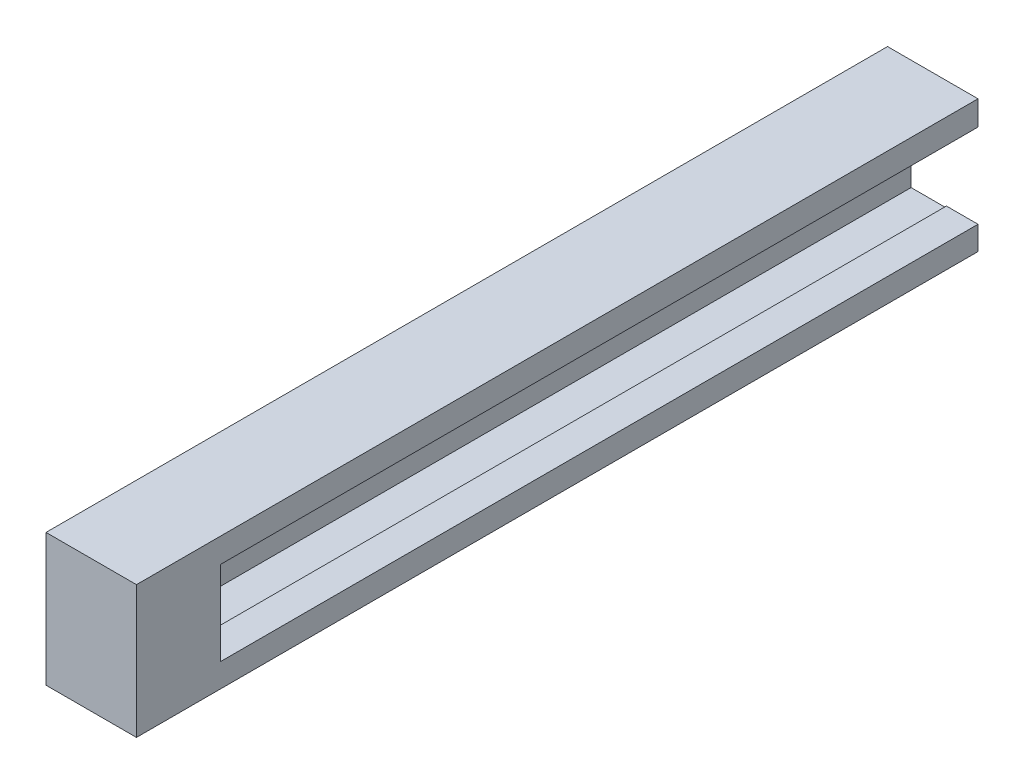
from build123d import *

# Parameters (mm, degrees)
BOSS_EXTRUDE3_DEPTH   = 90
BOSS_EXTRUDE3_2_DEPTH = 90
SKETCH3_W             = 10.75
SKETCH3_H             = 15.726491146
BOSS_EXTRUDE4_DEPTH   = 10


with BuildPart() as part:
    # Sketch2 → Boss-Extrude3 (new body)
    with BuildSketch(Plane.XY):
        Polygon((16.75, 6), (13, 6), (13, 5.8), (8.8, 5.8), (8.8, 8.3), (6, 8.3), (6, 3.186754427), (16.75, 3.186754427), align=None)
    extrude(amount=BOSS_EXTRUDE3_DEPTH)



with BuildPart() as body_2:
    # Sketch2 → Boss-Extrude3 2 (new body)
    with BuildSketch(Plane.XY):
        Polygon((6, 18.913245573), (6, 13.8), (8.7, 13.8), (8.7, 16.3), (13, 16.3), (13, 16), (16.75, 16), (16.75, 18.913245573), align=None)
    extrude(amount=BOSS_EXTRUDE3_2_DEPTH)


with BuildPart() as part_1:
    add(part.part)

    add(body_2.part)  # Boss-Extrude4 merges body 2
    # Sketch3 → Boss-Extrude4 (add)
    with BuildSketch(Plane.XY.offset(90)):
        with Locations((11.375, 11.05)):
            Rectangle(SKETCH3_W, SKETCH3_H)
    extrude(amount=BOSS_EXTRUDE4_DEPTH)


solid = part_1.part
